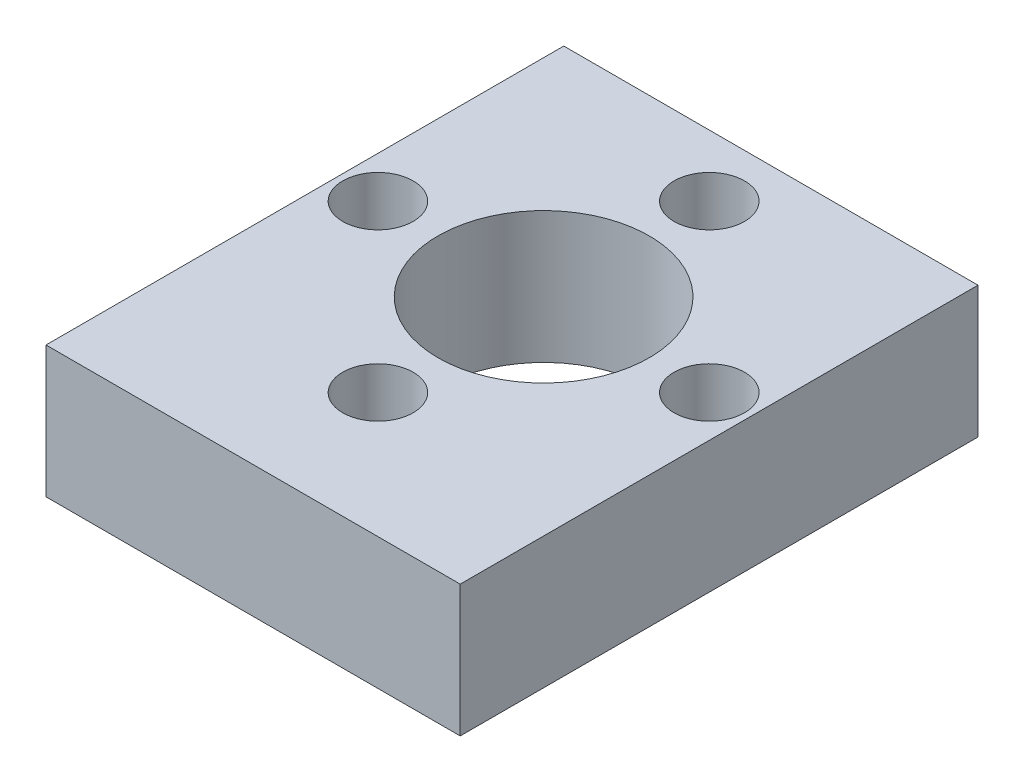
from build123d import *

# Parameters (mm, degrees)
SKETCH1_W                       = 20
SKETCH1_H                       = 25
SKETCH1_R                       = 5.1
BOSS_EXTRUDE1_DEPTH             = 6.35
M3_CLEARANCE_HOLE1_D            = 3.4
TAP_DRILL_FOR_M3X0_5_TAP3_D     = 2.5
TAP_DRILL_FOR_M3X0_5_TAP3_DEPTH = 6
TAP_DRILL_FOR_M3X0_5_TAP3_TIP   = 0.751075774


with BuildPart() as part:
    # Sketch1 → Boss-Extrude1 (new body)
    with BuildSketch(Plane(origin=(0, 0, 0), x_dir=(1, 0, 0), z_dir=(0, 1, 0))):
        Rectangle(SKETCH1_W, SKETCH1_H)
        with Locations((0, 1.5261946)):
            Circle(SKETCH1_R, mode=Mode.SUBTRACT)
    extrude(amount=BOSS_EXTRUDE1_DEPTH)

    # M3 Clearance Hole1 (through all)
    with Locations(Plane(origin=(0, 6.35, 0), x_dir=(1, 0, 0), z_dir=(0, 1, 0))):
        with Locations((-8, 1.5261946), (0, 9.5261946), (8, 1.5261946), (0, -6.4738054)):
            Hole(M3_CLEARANCE_HOLE1_D / 2)

    # Tap Drill for M3x0.5 Tap3
    with Locations(Plane(origin=(0, 0, -12.5), x_dir=(-1, 0, 0), z_dir=(0, 0, -1))):
        with Locations((-7.62, 3.175), (7.62, 3.175)):
            Hole(TAP_DRILL_FOR_M3X0_5_TAP3_D / 2, depth=TAP_DRILL_FOR_M3X0_5_TAP3_DEPTH)
            with Locations((0, 0, -(TAP_DRILL_FOR_M3X0_5_TAP3_DEPTH + TAP_DRILL_FOR_M3X0_5_TAP3_TIP / 2))):  # 118° drill point
                Cone(0, TAP_DRILL_FOR_M3X0_5_TAP3_D / 2, TAP_DRILL_FOR_M3X0_5_TAP3_TIP, mode=Mode.SUBTRACT)


solid = part.part
